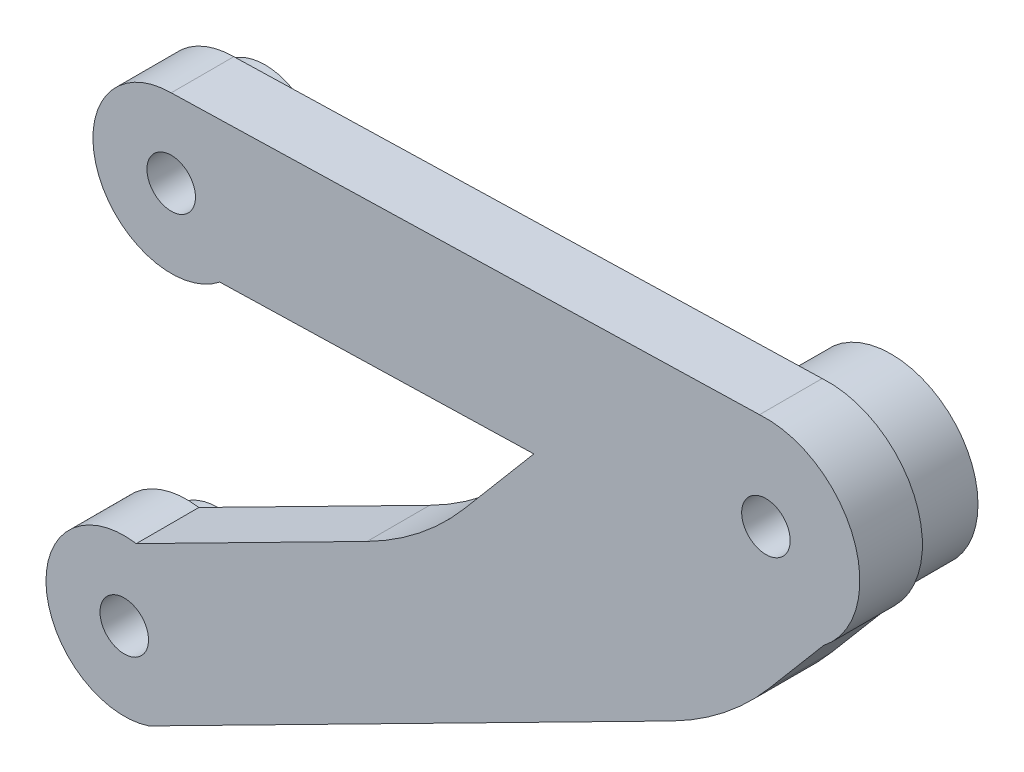
from build123d import *
from build123d.topology import SkipClean

# Parameters (mm, degrees)
BOSS_EXTRUDE1_DEPTH      = 2
BOSS_EXTRUDE1_DEPTH_BACK = 2
SKETCH2_R                = 1.55
FILLET1_R                = 20
BOSS_EXTRUDE4_START      = 4
SKETCH7_R                = 5.55
SKETCH7_R_2              = 1.55
BOSS_EXTRUDE4_DEPTH      = 4
BOSS_EXTRUDE5_START      = 2
SKETCH8_R                = 3.55
SKETCH8_R_2              = 1.55
BOSS_EXTRUDE5_DEPTH      = 2


with BuildPart() as part:
    # Sketch2 → Boss-Extrude1 (new, two sides: drawn at the far end of the back side and taken through both)
    with BuildSketch(Plane.XY.offset(-BOSS_EXTRUDE1_DEPTH_BACK)):
        with BuildLine():
            ThreePointArc((0.76923556, 4.940473323), (-4.982755324, -0.41490888), (1.575752274, -4.745208612))
            Line((1.575752274, -4.745208612), (38.598254294, 14.069940073))
            Line((38.598254294, 14.069940073), (44.683748534, 21.26396825))
            ThreePointArc((44.683748534, 21.26396825), (46.605489471, 28.139740122), (40.590896347, 31.986036602))
            Line((40.590896347, 31.986036602), (3, 31))
            ThreePointArc((3, 31), (-1.722747684, 24.35815521), (6.101607472, 22.078261726))
            Line((6.101607472, 22.078261726), (26.170960727, 22.604695486))
            Line((26.170960727, 22.604695486), (19.115779569, 14.264342174))
            Line((19.115779569, 14.264342174), (0.76923556, 4.940473323))
        make_face()
        Circle(SKETCH2_R, mode=Mode.SUBTRACT)
        with Locations((3, 26)):
            Circle(SKETCH2_R, mode=Mode.SUBTRACT)
        with Locations((41, 26)):
            Circle(SKETCH2_R, mode=Mode.SUBTRACT)
    extrude(amount=BOSS_EXTRUDE1_DEPTH + BOSS_EXTRUDE1_DEPTH_BACK)

    # Fillet1
    fillet1_edges = [part.edges().sort_by_distance(p)[0] for p in [
        (38.598254294, 14.069940073, 0),
        (19.115779569, 14.264342174, 0),
    ]]
    fillet(fillet1_edges, radius=FILLET1_R)

    # Sketch7 → Boss-Extrude4 (add)
    with SkipClean():  # the faces are left unmerged after this step: merging them gives an invalid solid
        with BuildSketch(Plane(origin=(0, 0, -2), x_dir=(-1, 0, 0), z_dir=(0, 0, -1)).offset(BOSS_EXTRUDE4_START)):
            with Locations((-41, 26)):
                Circle(SKETCH7_R)
            with Locations((-41, 26)):
                Circle(SKETCH7_R_2, mode=Mode.SUBTRACT)
        extrude(amount=-BOSS_EXTRUDE4_DEPTH)

    # Sketch8 → Boss-Extrude5 (add)
    # profile 1 of 2: a face of its own
    with SkipClean():  # the faces are left unmerged after this step: merging them gives an invalid solid
        with BuildSketch(Plane(origin=(0, 0, -2), x_dir=(-1, 0, 0), z_dir=(0, 0, -1)).offset(BOSS_EXTRUDE5_START)):
            with Locations((-3, 26)):
                Circle(SKETCH8_R)
            with Locations((-3, 26)):
                Circle(SKETCH8_R_2, mode=Mode.SUBTRACT)
        # profile 2 of 2: a face of its own
        with BuildSketch(Plane(origin=(0, 0, -2), x_dir=(-1, 0, 0), z_dir=(0, 0, -1)).offset(BOSS_EXTRUDE5_START)):
            Circle(SKETCH8_R)
            Circle(SKETCH8_R_2, mode=Mode.SUBTRACT)
        extrude(amount=-BOSS_EXTRUDE5_DEPTH)


solid = part.part
